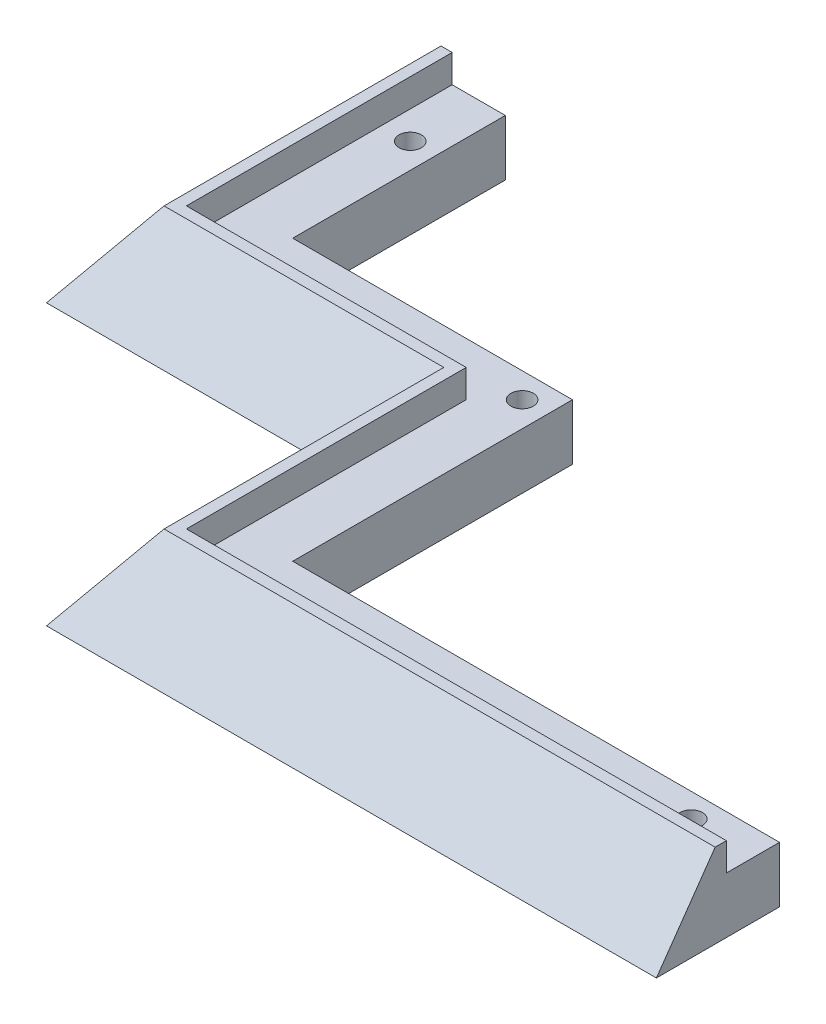
from build123d import *
from OCP.BRepFilletAPI import BRepFilletAPI_MakeChamfer

# Parameters (mm, degrees)
BOSS_EXTRU_1_DEPTH      = 15
CHANFREIN1_SIZE         = 10.503113073
CHANFREIN1_SIZE_2       = 15
ESQUISSE4_R             = 2
ENL_V_MAT_EXTRU_3_DEPTH = 4
ENL_V_MAT_EXTRU_5_DEPTH = 5
ESQUISSE6_R             = 2
ENL_V_MAT_EXTRU_6_DEPTH = 5


with BuildPart() as part:
    # Esquisse1 → Boss.-Extru.1 (new body)
    with BuildSketch(Plane(origin=(0, 0, 0), x_dir=(1, 0, 0), z_dir=(0, 1, 0))):
        Polygon((-41.352348911, -18.647651089), (8.647651089, -18.647651089), (8.647651089, -68.647651089), (68.647651089, -68.647651089), (117.647651089, -68.647651089), (117.647651089, -46.647651089), (68.647651089, -46.647651089), (30.647651089, -46.647651089), (30.647651089, 3.352348911), (-19.352348911, 3.352348911), (-19.352348911, 41.352348911), (-41.352348911, 41.352348911), align=None)
    extrude(amount=BOSS_EXTRU_1_DEPTH)

    # Chanfrein1
    chanfrein1_edges_1 = [part.edges().sort_by_distance(p)[0] for p in [
        (63.147651089, 15, 68.647651089),
    ]]
    chanfrein1_side_1 = [part.faces().sort_by_distance(p)[0] for p in [
        (63.147651089, 15, 68.437588827),
    ]]
    chanfrein1_edges_2 = [part.edges().sort_by_distance(p)[0] for p in [
        (8.647651089, 15, 43.647651089),
    ]]
    chanfrein1_side_2 = [part.faces().sort_by_distance(p)[0] for p in [
        (8.85771335, 15, 43.647651089),
    ]]
    chanfrein1_edges_3 = [part.edges().sort_by_distance(p)[0] for p in [
        (-16.352348911, 15, 18.647651089),
    ]]
    chanfrein1_side_3 = [part.faces().sort_by_distance(p)[0] for p in [
        (-16.352348911, 14.789937739, 18.647651089),
    ]]
    chanfrein1_edges_4 = [part.edges().sort_by_distance(p)[0] for p in [
        (-41.352348911, 15, -11.352348911),
    ]]
    chanfrein1_side_4 = [part.faces().sort_by_distance(p)[0] for p in [
        (-41.14228665, 15, -11.352348911),
    ]]
    chanfrein1 = BRepFilletAPI_MakeChamfer(part.part.solid().wrapped)
    for e in chanfrein1_edges_1:
        chanfrein1.Add(CHANFREIN1_SIZE - 0.0001, CHANFREIN1_SIZE_2 - 0.0001, e.wrapped, chanfrein1_side_1[0].wrapped)
    for e in chanfrein1_edges_2:
        chanfrein1.Add(CHANFREIN1_SIZE - 0.0001, CHANFREIN1_SIZE_2 - 0.0001, e.wrapped, chanfrein1_side_2[0].wrapped)
    for e in chanfrein1_edges_3:
        chanfrein1.Add(CHANFREIN1_SIZE_2 - 0.0001, CHANFREIN1_SIZE - 0.0001, e.wrapped, chanfrein1_side_3[0].wrapped)
    for e in chanfrein1_edges_4:
        chanfrein1.Add(CHANFREIN1_SIZE - 0.0001, CHANFREIN1_SIZE_2 - 0.0001, e.wrapped, chanfrein1_side_4[0].wrapped)
    add(Compound.cast(chanfrein1.Shape()), mode=Mode.REPLACE)  # a hair under: the kernel refuses the full size

    # Esquisse4 → Enlèv. mat.-Extru.3 (cut)
    with BuildSketch(Plane.XZ):
        with Locations(Location((38.647651089, 63.647651089, 0), (0, 0, 270))):
            Circle(ESQUISSE4_R)
        with Locations(Location((13.647651089, 38.647651089, 0), (0, 0, 270))):
            Circle(ESQUISSE4_R)
        with Locations(Location((-11.352348911, 13.647651089, 0), (0, 0, 270))):
            Circle(ESQUISSE4_R)
    extrude(amount=-ENL_V_MAT_EXTRU_3_DEPTH, mode=Mode.SUBTRACT)

    # Esquisse5 → Enlèv. mat.-Extru.5 (cut)
    with BuildSketch(Plane(origin=(0, 15, 0), x_dir=(1, 0, 0), z_dir=(0, 1, 0))):
        Polygon((-28.849235838, 41.352348911), (-19.352348911, 41.352348911), (-19.352348911, 3.352348911), (30.647651089, 3.352348911), (30.647651089, -46.647651089), (117.647651089, -46.647651089), (117.647651089, -56.140382231), (21.150764162, -56.140382231), (21.150764162, -6.144538016), (-28.849235838, -6.144538016), align=None)
    extrude(amount=-ENL_V_MAT_EXTRU_5_DEPTH, mode=Mode.SUBTRACT)

    # Esquisse6 → Enlèv. mat.-Extru.6 (cut)
    with BuildSketch(Plane(origin=(0, 10, 0), x_dir=(1, 0, 0), z_dir=(0, 1, 0))):
        with Locations(Location((-23.849235838, 28.855461984, 0), (0, 0, 270))):
            Circle(ESQUISSE6_R)
        with Locations(Location((26.150764162, -1.144538016, 0), (0, 0, 270))):
            Circle(ESQUISSE6_R)
        with Locations(Location((106.150456792, -50.918618661, 0), (0, 0, 270))):
            Circle(ESQUISSE6_R)
    extrude(amount=-ENL_V_MAT_EXTRU_6_DEPTH, mode=Mode.SUBTRACT)


solid = part.part
